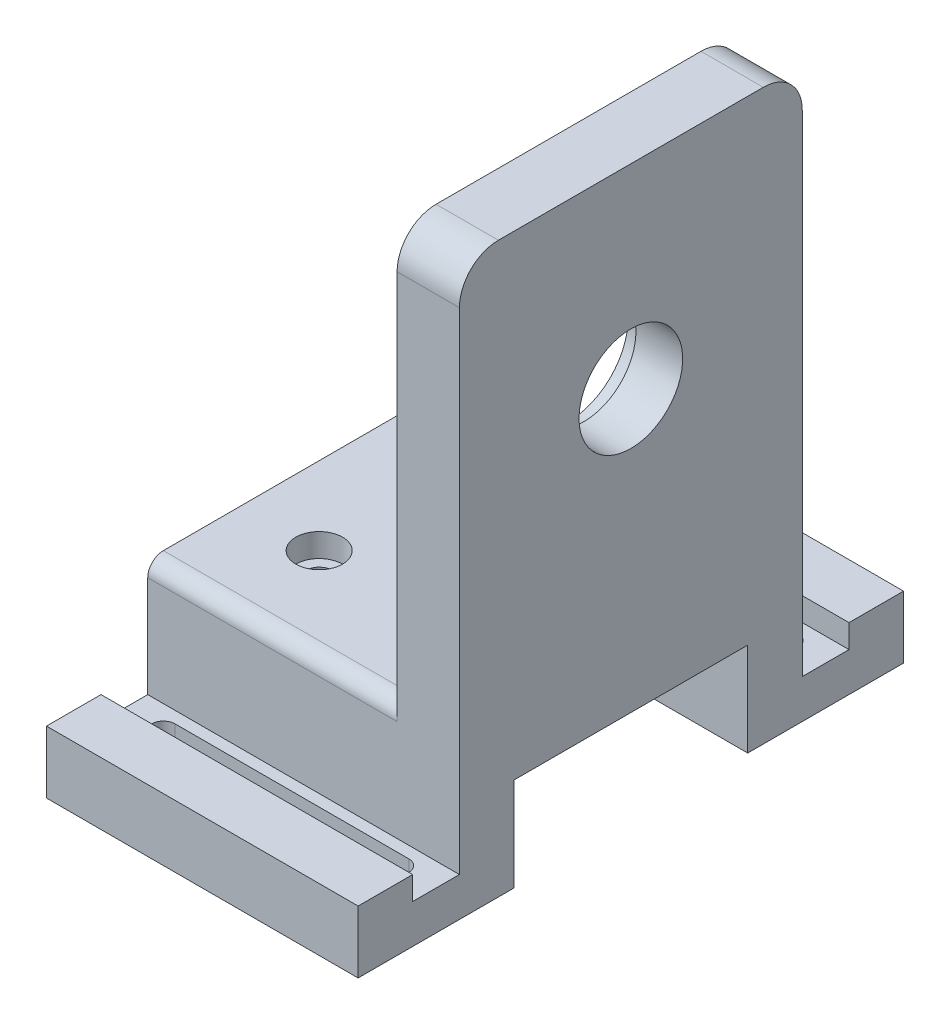
from build123d import *

# Parameters (mm, degrees)
SKETCH1_W           = 40
SKETCH1_H           = 70
BOSS_EXTRUDE1_DEPTH = 20
SKETCH2_W           = 30
SKETCH2_H           = 24
CUT_EXTRUDE1_DEPTH  = 57.789083458
SKETCH3_R           = 1.65
CUT_EXTRUDE2_DEPTH  = 46
SKETCH5_R           = 3
CUT_EXTRUDE3_DEPTH  = 3
SKETCH9_W           = 6
SKETCH9_H           = 30
CUT_EXTRUDE6_DEPTH  = 57.789083458
CUT_EXTRUDE7_DEPTH  = 10
SKETCH14_W          = 8
SKETCH14_H          = 44
BOSS_EXTRUDE3_DEPTH = 53
SKETCH16_R          = 6.65
CUT_EXTRUDE11_DEPTH = 88.051708771
SKETCH17_R          = 7.65
CUT_EXTRUDE12_DEPTH = 2
FILLET2_R           = 5
SKETCH18_R          = 3
CUT_EXTRUDE13_DEPTH = 18
CHAMFER1_SIZE       = 2
SKETCH19_W          = 7
SKETCH19_H          = 12
CUT_EXTRUDE14_DEPTH = 91.29950166
FILLET4_R           = 2


with BuildPart() as part:
    # Sketch1 → Boss-Extrude1 (new body)
    with BuildSketch(Plane(origin=(0, 0, 0), x_dir=(1, 0, 0), z_dir=(0, 1, 0))):
        Rectangle(SKETCH1_W, SKETCH1_H)
    extrude(amount=BOSS_EXTRUDE1_DEPTH)

    # Sketch2 → Cut-Extrude1 (cut, through all)
    with BuildSketch(Plane.ZY.offset(20)):
        Rectangle(SKETCH2_W, SKETCH2_H)
    extrude(amount=-CUT_EXTRUDE1_DEPTH, mode=Mode.SUBTRACT)

    # Sketch3 → Cut-Extrude2 (cut, through all)
    with BuildSketch(Plane(origin=(0, 20, 0), x_dir=(1, 0, 0), z_dir=(0, 1, 0))):
        with Locations(Location((-10, 10, 0), (0, 0, 270))):
            Circle(SKETCH3_R)
        with Locations(Location((10, 10, 0), (0, 0, 270))):
            Circle(SKETCH3_R)
        with Locations(Location((10, -10, 0), (0, 0, 270))):
            Circle(SKETCH3_R)
        with Locations(Location((-10, -10, 0), (0, 0, 270))):
            Circle(SKETCH3_R)
    extrude(amount=-CUT_EXTRUDE2_DEPTH, mode=Mode.SUBTRACT)

    # Sketch5 → Cut-Extrude3 (cut)
    with BuildSketch(Plane(origin=(0, 20, 0), x_dir=(1, 0, 0), z_dir=(0, 1, 0))):
        with Locations(Location((-10, 10, 0), (0, 0, 270))):
            Circle(SKETCH5_R)
        with Locations(Location((10, 10, 0), (0, 0, 270))):
            Circle(SKETCH5_R)
        with Locations(Location((10, -10, 0), (0, 0, 270))):
            Circle(SKETCH5_R)
        with Locations(Location((-10, -10, 0), (0, 0, 270))):
            Circle(SKETCH5_R)
    extrude(amount=-CUT_EXTRUDE3_DEPTH, mode=Mode.SUBTRACT)

    # Sketch9 → Cut-Extrude6 (cut, through all)
    with BuildSketch(Plane(origin=(20, 0, 0), x_dir=(0, 0, -1), z_dir=(1, 0, 0))):
        with Locations((25, 20)):
            Rectangle(SKETCH9_W, SKETCH9_H)
    cut_extrude6 = extrude(amount=-CUT_EXTRUDE6_DEPTH, mode=Mode.SUBTRACT)

    # Sketch10 → Cut-Extrude7 (cut)
    with BuildSketch(Plane(origin=(0, 5, 0), x_dir=(1, 0, 0), z_dir=(0, 1, 0))):
        with BuildLine():
            Line((15, 23.5), (-15, 23.5))
            ThreePointArc((-15, 23.5), (-16.5, 25), (-15, 26.5))
            Line((-15, 26.5), (15, 26.5))
            ThreePointArc((15, 26.5), (16.5, 25), (15, 23.5))
        make_face()
    cut_extrude7 = extrude(amount=-CUT_EXTRUDE7_DEPTH, mode=Mode.SUBTRACT)

    # Mirror2: Cut-Extrude6, Cut-Extrude7 across plane
    add(cut_extrude6.mirror(Plane.XY), mode=Mode.SUBTRACT)
    add(cut_extrude7.mirror(Plane.XY), mode=Mode.SUBTRACT)

    # Sketch14 → Boss-Extrude3 (add)
    with BuildSketch(Plane(origin=(0, 20, 0), x_dir=(1, 0, 0), z_dir=(0, 1, 0))):
        with Locations((16, 0)):
            Rectangle(SKETCH14_W, SKETCH14_H)
    extrude(amount=BOSS_EXTRUDE3_DEPTH)

    # Sketch16 → Cut-Extrude11 (cut, through all)
    with BuildSketch(Plane.ZY.offset(-12)):
        with Locations((0, 48)):
            Circle(SKETCH16_R)
    extrude(amount=-CUT_EXTRUDE11_DEPTH, mode=Mode.SUBTRACT)

    # Sketch17 → Cut-Extrude12 (cut)
    with BuildSketch(Plane.ZY.offset(-12)):
        with Locations((0, 48)):
            Circle(SKETCH17_R)
    extrude(amount=-CUT_EXTRUDE12_DEPTH, mode=Mode.SUBTRACT)

    # Fillet2
    fillet2_edges = [part.edges().sort_by_distance(p)[0] for p in [
        (16, 73, -22),
        (16, 73, 22),
    ]]
    fillet(fillet2_edges, radius=FILLET2_R)

    # Sketch18 → Cut-Extrude13 (cut)
    with BuildSketch(Plane(origin=(0, 38, 0), x_dir=(1, 0, 0), z_dir=(0, 1, 0))):
        with Locations(Location((10, 10, 0), (0, 0, 270))):
            Circle(SKETCH18_R)
        with Locations(Location((10, -10, 0), (0, 0, 270))):
            Circle(SKETCH18_R)
    extrude(amount=-CUT_EXTRUDE13_DEPTH, mode=Mode.SUBTRACT)

    # Chamfer1
    # the kernel refuses this chamfer: 2 mm, written as the material it takes off along each edge
    with BuildSketch(Plane(origin=(12, 38, 17.379433953), x_dir=(-0.02749587661058651, 0.9996219169112968, 0), z_dir=(0, 0, -1))) as chamfer1_piece_1_section:
        Polygon((CHAMFER1_SIZE * 0.999621916911, CHAMFER1_SIZE * 0.0274958766106), (-CHAMFER1_SIZE * 0.0274958766106, CHAMFER1_SIZE * 0.999621916911), (0, 0), align=None)
    chamfer1_piece_1 = extrude(amount=14.758867907, mode=Mode.PRIVATE)
    chamfer1_piece_1 = chamfer1_piece_1 & Plane(origin=(10, 38.83392746, 10), x_dir=(0, 0, 1), z_dir=(0, 1, 0)) * Cylinder(3, 38, mode=Mode.PRIVATE)
    add(chamfer1_piece_1, mode=Mode.SUBTRACT)
    with BuildSketch(Plane(origin=(12, 38, -2.620566047), x_dir=(-0.02749587661058651, 0.9996219169112968, 0), z_dir=(0, 0, -1))) as chamfer1_piece_2_section:
        Polygon((CHAMFER1_SIZE * 0.999621916911, CHAMFER1_SIZE * 0.0274958766106), (-CHAMFER1_SIZE * 0.0274958766106, CHAMFER1_SIZE * 0.999621916911), (0, 0), align=None)
    chamfer1_piece_2 = extrude(amount=14.758867907, mode=Mode.PRIVATE)
    chamfer1_piece_2 = chamfer1_piece_2 & Plane(origin=(10, 38.833927472, -10), x_dir=(0, 0, 1), z_dir=(0, 1, 0)) * Cylinder(3, 38, mode=Mode.PRIVATE)
    add(chamfer1_piece_2, mode=Mode.SUBTRACT)

    # Sketch19 → Cut-Extrude14 (cut, through all)
    with BuildSketch(Plane(origin=(20, 0, 0), x_dir=(0, 0, -1), z_dir=(1, 0, 0))):
        with Locations((-31.5, 14)):
            Rectangle(SKETCH19_W, SKETCH19_H)
    cut_extrude14 = extrude(amount=-CUT_EXTRUDE14_DEPTH, mode=Mode.SUBTRACT)

    # Mirror3: Cut-Extrude14 across plane
    add(cut_extrude14.mirror(Plane.XY), mode=Mode.SUBTRACT)

    # Fillet4
    fillet4_edges = [part.edges().sort_by_distance(p)[0] for p in [
        (-4, 20, 22),
        (-4, 20, -22),
    ]]
    fillet(fillet4_edges, radius=FILLET4_R)


solid = part.part
